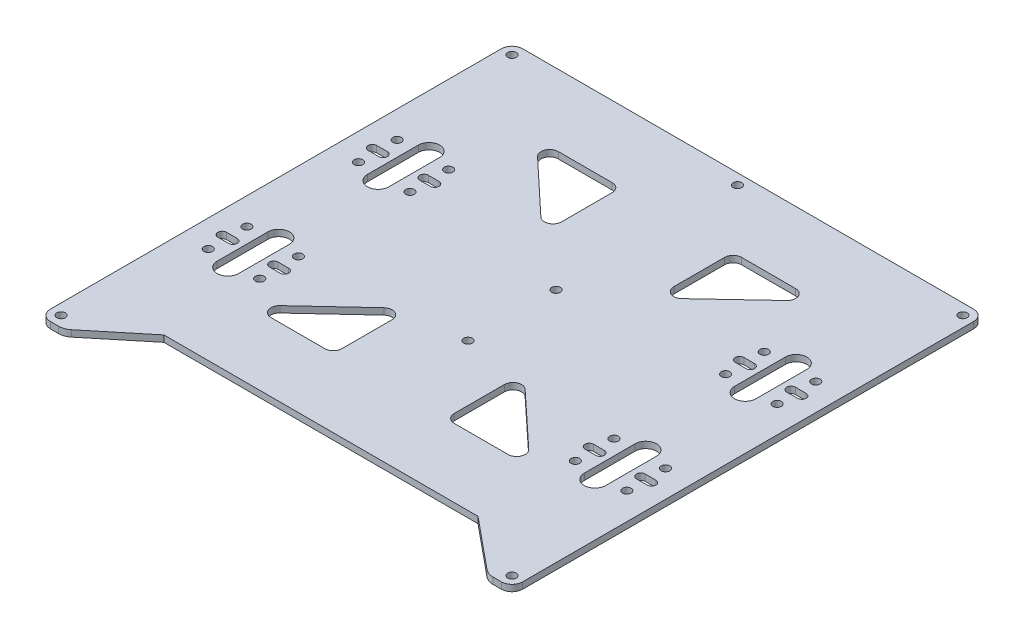
from build123d import *
from build123d.topology import SkipClean

# Parameters (mm, degrees)
SKETCH1_R            = 2
BOSS_EXTRUDE2_DEPTH  = 3
FILLET1_R            = 4
FILLET1_OF_MIRROR1_R = 4


with BuildPart() as part:
    # Sketch1 → Boss-Extrude2 (new body)
    with BuildSketch(Plane(origin=(0, 0, 0), x_dir=(1, 0, 0), z_dir=(0, 1, 0))):
        with BuildLine():
            Line((-0.567360549, 109.999952103), (-0.567360549, 106.999952103))
            ThreePointArc((-0.567360549, 106.999952103), (1.432639451, 104.999952103), (-0.567360549, 102.999952103))
            Line((-0.567360549, 102.999952103), (-0.567360549, 22.499952103))
            ThreePointArc((-0.567360549, 22.499952103), (1.432639451, 20.499952103), (-0.567360549, 18.499952103))
            Line((-0.567360549, 18.499952103), (-0.567360549, -18.500047897))
            ThreePointArc((-0.567360549, -18.500047897), (1.432639451, -20.500047897), (-0.567360549, -22.500047897))
            Line((-0.567360549, -22.500047897), (-0.567360549, -89.000047897))
            Line((-0.567360549, -89.000047897), (72.593143282, -89.000047897))
            Line((72.593143282, -89.000047897), (96.205566979, -108.407802041))
            ThreePointArc((96.205566979, -108.407802041), (98.289670456, -109.589975021), (100.650361138, -110.000047897))
            Line((100.650361138, -110.000047897), (104.432639451, -110.000047897))
            ThreePointArc((104.432639451, -110.000047897), (107.968173357, -108.535581803), (109.432639451, -105.000047897))
            Line((109.432639451, -105.000047897), (109.432639451, -4.7897e-05))
            Line((109.432639451, -4.7897e-05), (109.432639451, 104.999952103))
            ThreePointArc((109.432639451, 104.999952103), (107.968173357, 108.535486009), (104.432639451, 109.999952103))
            Line((104.432639451, 109.999952103), (-0.567360549, 109.999952103))
        make_face()
        with Locations((104.432639451, 104.999952103)):
            Circle(SKETCH1_R, mode=Mode.SUBTRACT)
        with Locations((104.432639451, -105.000047897)):
            Circle(SKETCH1_R, mode=Mode.SUBTRACT)
        with Locations((96.932639451, 25.999952103)):
            Circle(SKETCH1_R, mode=Mode.SUBTRACT)
        with Locations((72.932639451, 25.999952103)):
            Circle(SKETCH1_R, mode=Mode.SUBTRACT)
        with Locations((72.932639451, 43.999952103)):
            Circle(SKETCH1_R, mode=Mode.SUBTRACT)
        with Locations((96.932639451, -44.000047897)):
            Circle(SKETCH1_R, mode=Mode.SUBTRACT)
        with Locations((72.932639451, -44.000047897)):
            Circle(SKETCH1_R, mode=Mode.SUBTRACT)
        with Locations((72.932639451, -26.000047897)):
            Circle(SKETCH1_R, mode=Mode.SUBTRACT)
        with Locations((96.932639451, -26.000047897)):
            Circle(SKETCH1_R, mode=Mode.SUBTRACT)
        with Locations((96.932639451, 43.999952103)):
            Circle(SKETCH1_R, mode=Mode.SUBTRACT)
        Polygon((25.578501747, 39.999952103), (25.578501747, 76.833921846), (64.808861855, 76.833921846), align=None, mode=Mode.SUBTRACT)
        Polygon((25.578501747, -20.500095793), (25.578501747, -57.061589457), (64.808861855, -57.061589457), align=None, mode=Mode.SUBTRACT)
        with BuildLine():
            Line((89.932639451, -23.164859069), (89.932639451, -46.835236724))
            ThreePointArc((89.932639451, -46.835236724), (84.932639451, -51.835236724), (79.932639451, -46.835236724))
            Line((79.932639451, -46.835236724), (79.932639451, -23.164859069))
            ThreePointArc((79.932639451, -23.164859069), (84.932639451, -18.164859069), (89.932639451, -23.164859069))
        make_face(mode=Mode.SUBTRACT)
        with BuildLine():
            Line((70.432639451, -33.000047897), (75.432639451, -33.000047897))
            ThreePointArc((75.432639451, -33.000047897), (77.432639451, -35.000047897), (75.432639451, -37.000047897))
            Line((75.432639451, -37.000047897), (70.432639451, -37.000047897))
            ThreePointArc((70.432639451, -37.000047897), (68.432639451, -35.000047897), (70.432639451, -33.000047897))
        make_face(mode=Mode.SUBTRACT)
        with BuildLine():
            Line((94.432639451, -33.000047897), (99.432639451, -33.000047897))
            ThreePointArc((99.432639451, -33.000047897), (101.432639451, -35.000047897), (99.432639451, -37.000047897))
            Line((99.432639451, -37.000047897), (94.432639451, -37.000047897))
            ThreePointArc((94.432639451, -37.000047897), (92.432639451, -35.000047897), (94.432639451, -33.000047897))
        make_face(mode=Mode.SUBTRACT)
        with BuildLine():
            Line((89.932639451, 23.164763276), (89.932639451, 46.835140931))
            ThreePointArc((89.932639451, 46.835140931), (84.932639451, 51.835140931), (79.932639451, 46.835140931))
            Line((79.932639451, 46.835140931), (79.932639451, 23.164763276))
            ThreePointArc((79.932639451, 23.164763276), (84.932639451, 18.164763276), (89.932639451, 23.164763276))
        make_face(mode=Mode.SUBTRACT)
        with BuildLine():
            Line((70.432639451, 32.999952103), (75.432639451, 32.999952103))
            ThreePointArc((75.432639451, 32.999952103), (77.432639451, 34.999952103), (75.432639451, 36.999952103))
            Line((75.432639451, 36.999952103), (70.432639451, 36.999952103))
            ThreePointArc((70.432639451, 36.999952103), (68.432639451, 34.999952103), (70.432639451, 32.999952103))
        make_face(mode=Mode.SUBTRACT)
        with BuildLine():
            Line((94.432639451, 32.999952103), (99.432639451, 32.999952103))
            ThreePointArc((99.432639451, 32.999952103), (101.432639451, 34.999952103), (99.432639451, 36.999952103))
            Line((99.432639451, 36.999952103), (94.432639451, 36.999952103))
            ThreePointArc((94.432639451, 36.999952103), (92.432639451, 34.999952103), (94.432639451, 32.999952103))
        make_face(mode=Mode.SUBTRACT)
    boss_extrude2 = extrude(amount=BOSS_EXTRUDE2_DEPTH)

    # Fillet1
    fillet1_edges = [part.edges().sort_by_distance(p)[0] for p in [
        (64.808861855, 1.5, 57.061589457),
        (25.578501747, 1.5, 57.061589457),
        (25.578501747, 1.5, 20.500095793),
        (25.578501747, 1.5, -39.999952103),
        (25.578501747, 1.5, -76.833921846),
        (64.808861855, 1.5, -76.833921846),
    ]]
    fillet(fillet1_edges, radius=FILLET1_R)

    # Mirror1: Boss-Extrude2 across plane
    with SkipClean():  # the faces are left unmerged after this step: merging them gives an invalid solid
        add(boss_extrude2.mirror(Plane(origin=(-0.567360549, 3, -102.999952103), x_dir=(0, 0, 1), z_dir=(1, 0, 0))))

    # Fillet1 of Mirror1
    fillet1_of_mirror1_edges = [part.edges().sort_by_distance(p)[0] for p in [
        (-65.943582953, 1.5, 57.061589457),
        (-26.713222844, 1.5, 57.061589457),
        (-26.713222844, 1.5, 20.500095793),
        (-26.713222844, 1.5, -39.999952103),
        (-26.713222844, 1.5, -76.833921846),
        (-65.943582953, 1.5, -76.833921846),
    ]]
    fillet(fillet1_of_mirror1_edges, radius=FILLET1_OF_MIRROR1_R)


solid = part.part
